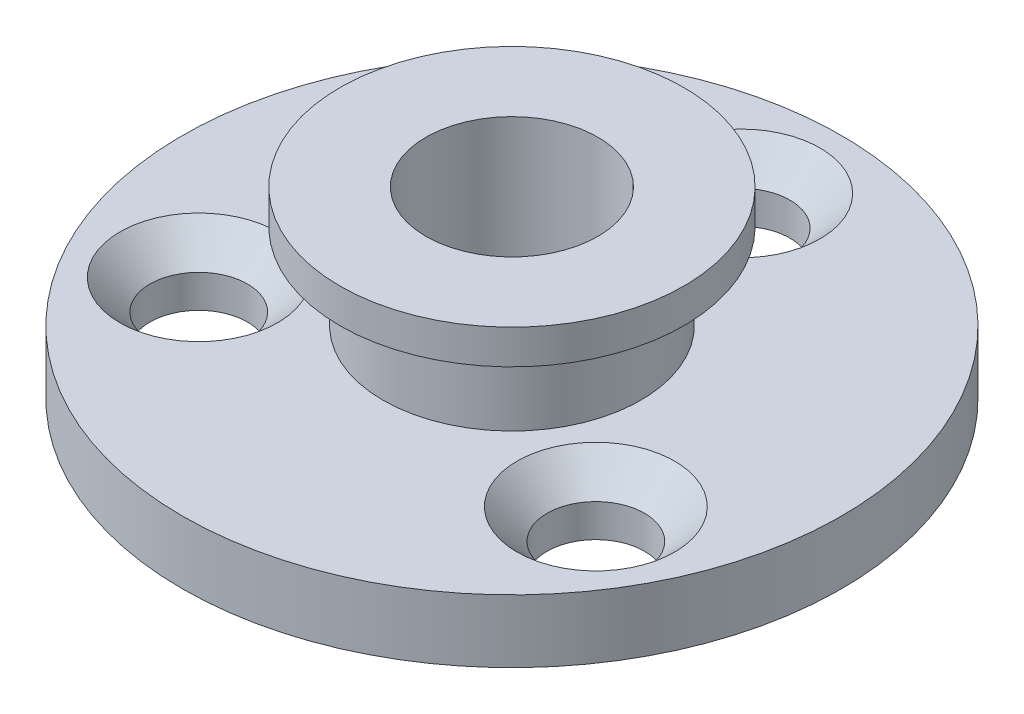
from build123d import *

# Parameters (mm, degrees)
CSK_FOR_M3_FLAT_HEAD_MACHINE_SCREW1_AT_2_COUNT = 2
CSK_FOR_M3_FLAT_HEAD_MACHINE_SCREW1_AT_2_PITCH = 13.856406461
CSK_FOR_M3_FLAT_HEAD_MACHINE_SCREW1_AT_3_COUNT = 2
CSK_FOR_M3_FLAT_HEAD_MACHINE_SCREW1_AT_3_PITCH = 13.856406461


with BuildPart() as part:
    # Esquisse1 → Révolution1 (revolve)
    with BuildSketch(Plane.XY):
        Polygon((3, -3.2), (3, 3.2), (6, 3.2), (6, 2), (4.5, 2), (4.5, -1), (11.5, -1), (11.5, -3.2), align=None)
    revolve(axis=Axis((0, 4.689873418, 0), (0, -1, 0)))

    # Esquisse4 → CSK for M3 Flat Head Machine Screw1 (revolve, cut)
    with BuildSketch(Plane(origin=(-6.92820323, -1, 4), x_dir=(0, 0, 1), z_dir=(1, 0, 0))):
        Polygon((0, 0), (0, 2.2), (1.7, 2.2), (1.7, 1.05), (2.75, 0), align=None)
    csk_for_m3_flat_head_machine_screw1 = revolve(axis=Axis((-6.92820323, 5.35, 4), (0, -1, 0)), mode=Mode.SUBTRACT)

    # CSK for M3 Flat Head Machine Screw1 at 2: CSK for M3 Flat Head Machine Screw1 ×2
    with Locations(*[(i * CSK_FOR_M3_FLAT_HEAD_MACHINE_SCREW1_AT_2_PITCH, 0, 0) for i in range(1, CSK_FOR_M3_FLAT_HEAD_MACHINE_SCREW1_AT_2_COUNT)]):
        add(csk_for_m3_flat_head_machine_screw1, mode=Mode.SUBTRACT)

    # CSK for M3 Flat Head Machine Screw1 at 3: CSK for M3 Flat Head Machine Screw1 ×2
    with Locations(*[Vector(0.5000000000000041, 0, -0.8660254037844364) * (i * CSK_FOR_M3_FLAT_HEAD_MACHINE_SCREW1_AT_3_PITCH) for i in range(1, CSK_FOR_M3_FLAT_HEAD_MACHINE_SCREW1_AT_3_COUNT)]):
        add(csk_for_m3_flat_head_machine_screw1, mode=Mode.SUBTRACT)


solid = part.part
